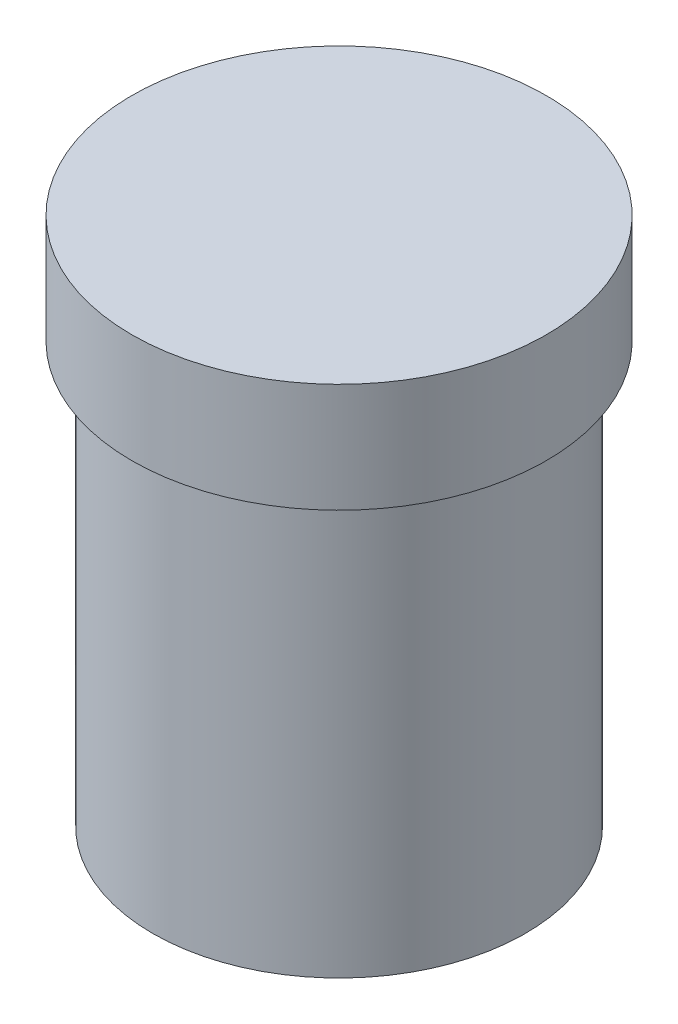
from build123d import *

# Parameters (mm, degrees)
SKETCH2_R           = 10.25
BOSS_EXTRUDE1_DEPTH = 23.1
SKETCH3_R           = 11.4
BOSS_EXTRUDE2_DEPTH = 6


with BuildPart() as part:
    # Sketch2 → Boss-Extrude1 (new body)
    with BuildSketch(Plane(origin=(0, 0, 0), x_dir=(1, 0, 0), z_dir=(0, 1, 0))):
        Circle(SKETCH2_R)
    extrude(amount=BOSS_EXTRUDE1_DEPTH)

    # Sketch3 → Boss-Extrude2 (add)
    with BuildSketch(Plane(origin=(0, 23.1, 0), x_dir=(1, 0, 0), z_dir=(0, 1, 0))):
        Circle(SKETCH3_R)
    extrude(amount=BOSS_EXTRUDE2_DEPTH)


solid = part.part
